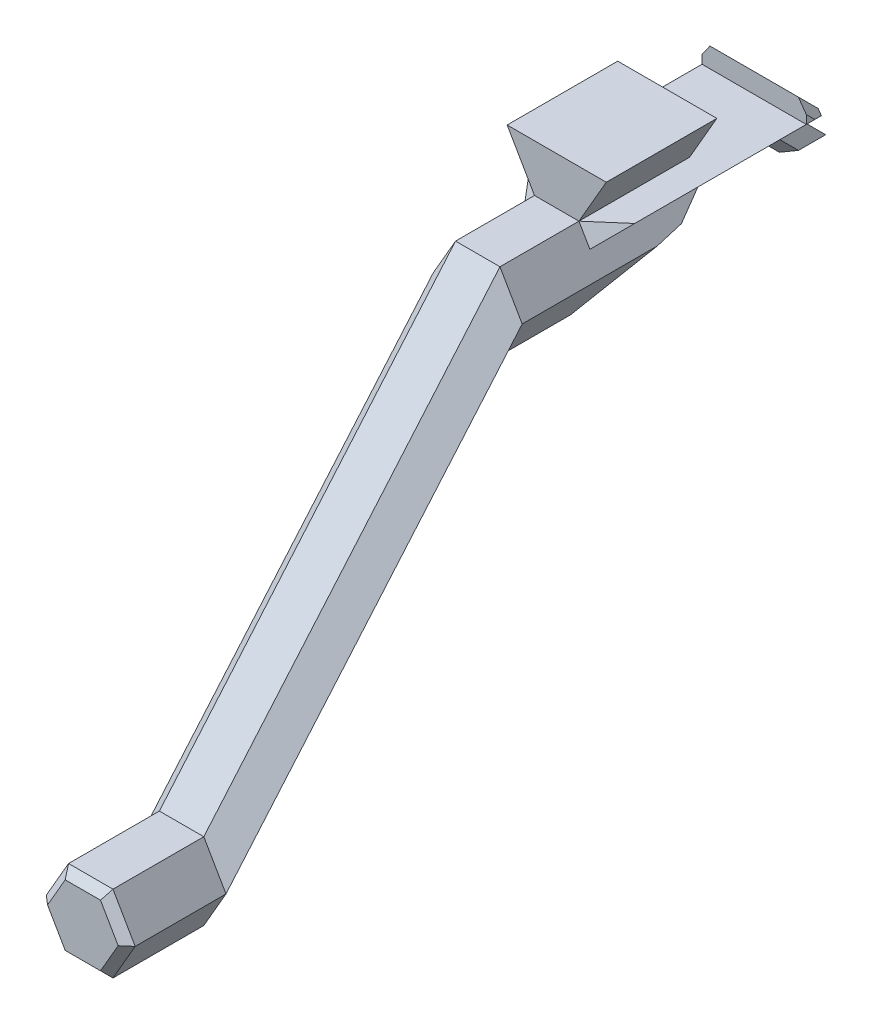
from build123d import *
from OCP.BRepFilletAPI import BRepFilletAPI_MakeChamfer

# Parameters (mm, degrees)
BOSS_EXTRUDE1_DEPTH      = 25.4
BOSS_EXTRUDE2_DEPTH      = 12.7
BOSS_EXTRUDE3_DEPTH      = 15.239999999999998
CHAMFER1_SIZE            = 7.46
CHAMFER1_SIZE2           = 12.540000000000001
BOSS_EXTRUDE4_DEPTH      = 12.7
BOSS_EXTRUDE5_DEPTH      = 24.384
BOSS_EXTRUDE6_DEPTH      = 4.265467
BOSS_EXTRUDE6_DEPTH_BACK = 4.265467
BOSS_EXTRUDE7_DEPTH      = 6.704137
BOSS_EXTRUDE7_DEPTH_BACK = 6.704137
CHAMFER2_SIZE            = 3.556
CHAMFER3_SIZE            = 1.016
CHAMFER3_SIZE2           = 2.1468318359684853
CHAMFER3_SIZE2_2         = 0.7623750143993072


with BuildPart() as part:
    # Sketch1 → Boss-Extrude1 (new body)
    with BuildSketch(Plane.XY):
        Polygon((5.715, 0), (2.8574999999999884, 4.949335182628073), (-2.857500000000022, 4.949335182628053), (-5.715, -3.991e-14), (-2.8574999999999533, -4.949335182628093), (2.8575000000000577, -4.949335182628033), align=None)
    extrude(amount=BOSS_EXTRUDE1_DEPTH)



with BuildPart() as body_2:
    # Sketch2 → Boss-Extrude2 (new body)
    with BuildSketch(Plane.XY.offset(63.5)):
        Polygon((-2.8574999999999533, -49.399335182628086), (2.8575000000000577, -49.399335182628036), (5.714999999999993, -44.45000000000016), (2.8574999999999884, -39.50066481737193), (-2.857500000000022, -39.50066481737194), (-5.715, -44.45000000000003), align=None)
    extrude(amount=BOSS_EXTRUDE2_DEPTH)


with BuildPart() as part_1:
    add(part.part)

    add(body_2.part)  # loft1 joins it to this body
    # loft from a face of the part (loft1)
    loft([part_1.faces().sort_by_distance((4.1e-15, -1.66e-15, 25.4))[0], part_1.faces().sort_by_distance((2.71e-15, -44.45000000000001, 63.5))[0]])

    # Sketch4 → Boss-Extrude3 (add)
    with BuildSketch(Plane(origin=(0, 0, 0), x_dir=(-1, 0, 0), z_dir=(0, 0, -1))):
        Polygon((2.857500000000022, 4.949335182628053), (6.3770272409799595, 11.045335182628051), (-6.377027240979914, 11.04533518262805), (-2.8574999999999884, 4.949335182628073), align=None)
    extrude(amount=-BOSS_EXTRUDE3_DEPTH)

    # Chamfer1
    chamfer1_edges = [part_1.edges().sort_by_distance(p)[0] for p in [
        (5.196e-14, -4.949335182628063, 0),
    ]]
    chamfer1_side = [part_1.faces().sort_by_distance(p)[0] for p in [
        (-7.04e-15, 3.3439435440816787, 0),
    ]]
    chamfer(chamfer1_edges, length=CHAMFER1_SIZE, length2=CHAMFER1_SIZE2, reference=chamfer1_side[0])

    # Sketch5 → Boss-Extrude4 (add)
    with BuildSketch(Plane(origin=(0, 0, 0), x_dir=(-1, 0, 0), z_dir=(0, 0, -1))):
        Polygon((-2.8574999999999884, 4.949335182628073), (2.857500000000022, 4.949335182628053), (4.265466991845397, 2.510664817371916), (-4.265466991845346, 2.5106648173720054), align=None)
    extrude(amount=BOSS_EXTRUDE4_DEPTH)

    # Sketch6 → Boss-Extrude5 (add)
    with BuildSketch(Plane(origin=(0, 0, -12.7), x_dir=(-1, 0, 0), z_dir=(0, 0, -1))):
        Polygon((-4.265466991845346, 2.5106648173720054), (-6.7041373571014065, 4.949335182628073), (-2.8574999999999884, 4.949335182628073), (2.857500000000022, 4.949335182628053), (6.7041373571013665, 4.949335182628074), (4.265466991845397, 2.510664817371916), align=None)
    extrude(amount=-BOSS_EXTRUDE5_DEPTH)

    # Sketch7 → Boss-Extrude6 (add, two sides: drawn at the far end of the back side and taken through both)
    with BuildSketch(Plane(origin=(0, 0, 0), x_dir=(0, 0, -1), z_dir=(1, 0, 0)).offset(-BOSS_EXTRUDE6_DEPTH_BACK)):
        Polygon((7.765575597798472, 2.5106648173720054), (10.159999999999973, 2.5106648173720054), (12.7, 2.5106648173720054), (15.094424402201499, 0.11624041517056517), (10.159999999999973, 0.11624041517056455), align=None)
    extrude(amount=BOSS_EXTRUDE6_DEPTH + BOSS_EXTRUDE6_DEPTH_BACK)

    # Sketch7<3> → Boss-Extrude7 (add, two sides: drawn at the far end of the back side and taken through both)
    with BuildSketch(Plane(origin=(0, 0, 0), x_dir=(0, 0, -1), z_dir=(1, 0, 0)).offset(-BOSS_EXTRUDE7_DEPTH_BACK)):
        Polygon((10.159999999999972, 7.489335182628074), (10.159999999999972, 4.949335182628073), (12.7, 4.949335182628073), align=None)
    extrude(amount=BOSS_EXTRUDE7_DEPTH + BOSS_EXTRUDE7_DEPTH_BACK)

    # Chamfer2
    # the kernel refuses this chamfer: 3.556 mm, written as the material it adds along each edge
    with BuildSketch(Plane(origin=(8.837919344448796, -5.409054972524991, 11.684000000000001), x_dir=(-0.023812127644090044, -0.013747938305293153, 0.9996219169112966), z_dir=(-0.500000000000001, 0.866025403784438, 0))) as chamfer2_piece_1_section:
        Polygon((CHAMFER2_SIZE * 0.999621916911, CHAMFER2_SIZE * 0.0274958766106), (-CHAMFER2_SIZE * 0.0274958766106, CHAMFER2_SIZE * 0.999621916911), (0, 0), align=None)
    chamfer2_piece_1 = extrude(amount=21.10574339410437, mode=Mode.PRIVATE)
    chamfer2_piece_1 = split(chamfer2_piece_1, bisect_by=Plane(origin=(5.0850917452486755, 3.330289570775337, 13.032835155075794), z_dir=(-0.7071067811865487, 0.7071067811865465, 0)), keep=Keep.TOP, mode=Mode.PRIVATE)
    chamfer2_piece_1 = split(chamfer2_piece_1, bisect_by=Plane(origin=(4.3712108447170275, 4.9493351826280785, 13.032835155075794), z_dir=(3.57e-15, -1, 0)), keep=Keep.TOP, mode=Mode.PRIVATE)
    add(chamfer2_piece_1)
    with BuildSketch(Plane(origin=(1.7149523526033228, 12.869054972524992, 11.684000000000001), x_dir=(0.023812127644090457, -0.013747938305293174, 0.9996219169112966), z_dir=(-0.4999999999999951, -0.8660254037844415, 0))) as chamfer2_piece_2_section:
        Polygon((CHAMFER2_SIZE * 0.999621916911, CHAMFER2_SIZE * 0.0274958766106), (-CHAMFER2_SIZE * 0.0274958766106, CHAMFER2_SIZE * 0.999621916911), (0, 0), align=None)
    chamfer2_piece_2 = extrude(amount=21.10574339410434, mode=Mode.PRIVATE)
    chamfer2_piece_2 = split(chamfer2_piece_2, bisect_by=Plane(origin=(-4.371210844717055, 4.949335182628047, 13.032835155075803), z_dir=(3.57e-15, -1, 0)), keep=Keep.TOP, mode=Mode.PRIVATE)
    chamfer2_piece_2 = split(chamfer2_piece_2, bisect_by=Plane(origin=(-5.085091745248726, 3.330289570775309, 13.032835155075805), z_dir=(0.7071067811865749, 0.7071067811865203, 0)), keep=Keep.TOP, mode=Mode.PRIVATE)
    add(chamfer2_piece_2)

    # Chamfer3: one chamfer whose edges measure the first distance from different faces: ONE call of the kernel's chamfer builder (chamfer() names one face for all edges)
    chamfer3_edges_1 = [part_1.edges().sort_by_distance(p)[0] for p in [
        (-4.265467, 1.3134526162712852, -8.962787798899223),
        (4.265467, 1.3134526162712852, -8.962787798899223),
        (-4.617263620489991, 7.997335182628052, 0),
        (-2.309e-14, 11.045335182628051, 0),
        (4.617263620489951, 7.997335182628062, 0),
        (-6.704137, 6.219335182628074, -11.429999999999986),
        (6.704137, 6.219335182628074, -11.429999999999986),
        (5.196e-14, -49.399335182628064, 76.2),
        (-4.286249999999977, -46.92466759131406, 76.2),
        (4.286250000000026, -46.9246675913141, 76.2),
        (-4.286250000000011, -41.975332408685986, 76.2),
        (4.28624999999999, -41.97533240868604, 76.2),
        (-1.688e-14, -39.500664817371934, 76.2),
    ]]
    chamfer3_edges_2 = [part_1.edges().sort_by_distance(p)[0] for p in [
        (-4.286249999999978, -2.4746675913140663, 8.380170027469429),
        (4.286250000000031, -2.4746675913140157, 8.380170027469497),
    ]]
    chamfer3_side_2 = [part_1.faces().sort_by_distance(p)[0] for p in [
        (1.357e-14, -0.9394076954343201, 5.7994516502132),
    ]]
    chamfer3_edges_3 = [part_1.edges().sort_by_distance(p)[0] for p in [
        (-4.990233495922706, 1.255332408685926, 2.1101700274694246),
        (4.990233495922681, 1.2553324086859914, 2.1101700274694926),
    ]]
    chamfer3_side_3 = [part_1.faces().sort_by_distance(p)[0] for p in [
        (1.357e-14, -0.9394076954343201, 5.7994516502132),
    ]]
    chamfer3 = BRepFilletAPI_MakeChamfer(part_1.part.solid().wrapped)
    for e in chamfer3_edges_1:
        chamfer3.Add(CHAMFER3_SIZE, e.wrapped)
    for e in chamfer3_edges_2:
        chamfer3.Add(CHAMFER3_SIZE, CHAMFER3_SIZE2, e.wrapped, chamfer3_side_2[0].wrapped)  # the first distance lies on this face
    for e in chamfer3_edges_3:
        chamfer3.Add(CHAMFER3_SIZE, CHAMFER3_SIZE2_2, e.wrapped, chamfer3_side_3[0].wrapped)  # the first distance lies on this face
    add(Compound.cast(chamfer3.Shape()), mode=Mode.REPLACE)


solid = part_1.part
